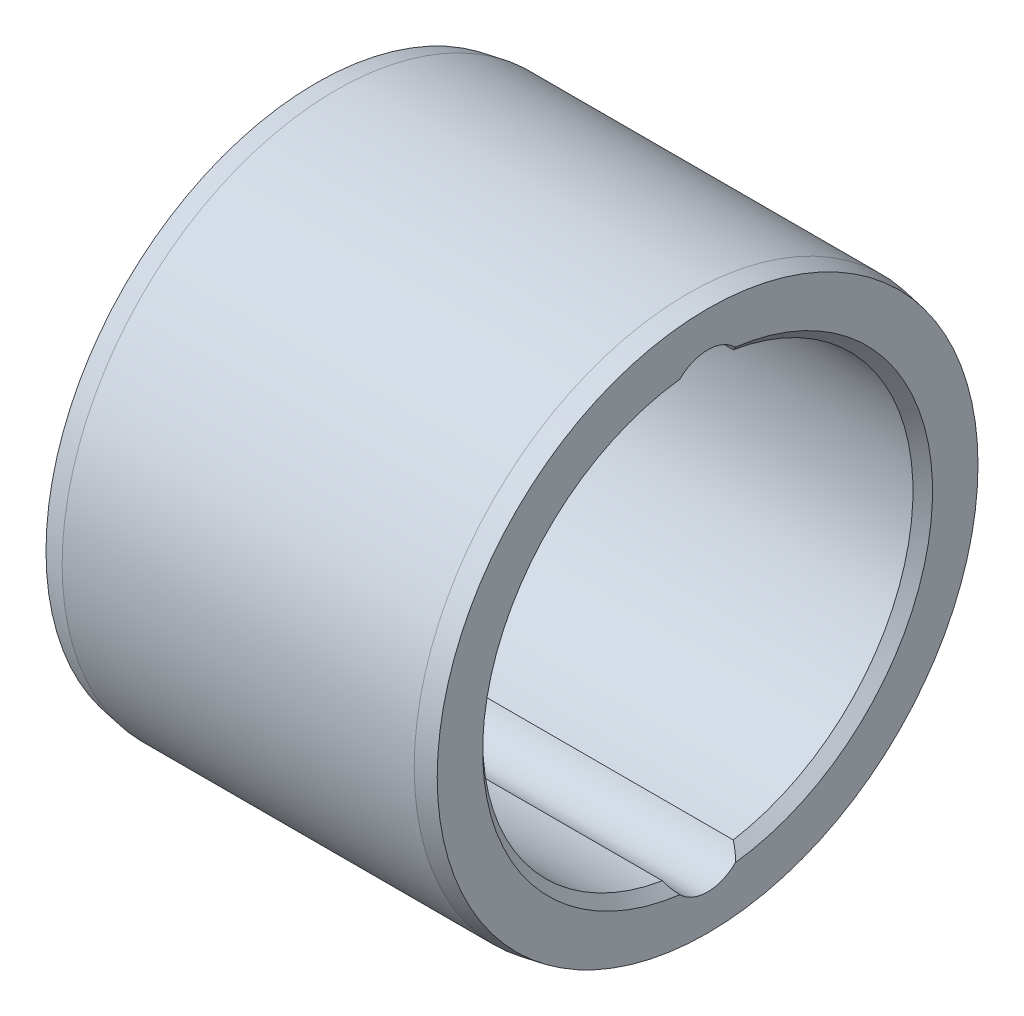
from build123d import *

# Parameters (mm, degrees)
CUT_EXTRUDE_START   = -18
CUT_EXTRUDE_1_DEPTH = 18
FILLET_1_R          = 1.5


with BuildPart() as part:
    # Эскиз1 → Повернуть1 (revolve)
    with BuildSketch(Plane.XY, mode=Mode.PRIVATE) as revolve_1_sk:
        Polygon((0, 11.5), (0, 13.823673019), (1, 14), (19, 14), (20, 13.823673019), (20, 11.5), (19.5, 11), (0.5, 11), align=None)
    revolve(revolve_1_sk.sketch.rotate(Axis((-7.002814628, 0, 0), (1, 0, 0)), 90), axis=Axis((-7.002814628, 0, 0), (1, 0, 0)))

    # Эскиз2 → Вырез-Вытянуть1 (cut)
    with BuildSketch(Plane(origin=(20, 0, 0), x_dir=(0, 0, -1), z_dir=(1, 0, 0)).offset(CUT_EXTRUDE_START)):
        with BuildLine():
            ThreePointArc((-1.810386699, -10.85), (0, -11), (1.810386699, -10.85))
            ThreePointArc((1.810386699, -10.85), (0, -12), (-1.810386699, -10.85))
        make_face()
        with BuildLine():
            ThreePointArc((-1.810386699, 10.85), (0, 12), (1.810386699, 10.85))
            ThreePointArc((1.810386699, 10.85), (0, 11), (-1.810386699, 10.85))
        make_face()
    extrude(amount=CUT_EXTRUDE_1_DEPTH, mode=Mode.SUBTRACT)

    # Скругление1
    # the kernel refuses this fillet: 1.5 mm, written as the material it adds along each edge
    with BuildSketch(Plane(origin=(2, 10, 0), x_dir=(0, -0.9911428491773114, 0.132800047156171), z_dir=(0, -0.132800047156171, -0.9911428491773114))) as fillet_1_piece_1_section:
        with BuildLine():
            CenterArc((2 - FILLET_1_R, -FILLET_1_R), FILLET_1_R, 0, 90)
            Line((2, -FILLET_1_R), (2, 0))
            Line((2, 0), (2 - FILLET_1_R, 0))
        make_face()
    fillet_1_piece_1 = revolve(axis=Axis((2, 10, 0), (-1, 0, 0)), revolution_arc=344.737147097, mode=Mode.PRIVATE)
    fillet_1_piece_1 = fillet_1_piece_1 - Plane(origin=(2.626804304, 0, 0), x_dir=(0, 0, 1), z_dir=(-1, 0, 0)) * Cylinder(11, 8, mode=Mode.PRIVATE)
    add(fillet_1_piece_1)
    with BuildSketch(Plane(origin=(2, -10, 0), x_dir=(0, 0.9911428491773114, -0.132800047156171), z_dir=(0, 0.132800047156171, 0.9911428491773114))) as fillet_1_piece_2_section:
        with BuildLine():
            CenterArc((2 - FILLET_1_R, -FILLET_1_R), FILLET_1_R, 0, 90)
            Line((2, -FILLET_1_R), (2, 0))
            Line((2, 0), (2 - FILLET_1_R, 0))
        make_face()
    fillet_1_piece_2 = revolve(axis=Axis((2, -10, 0), (-1, 0, 0)), revolution_arc=344.737147097, mode=Mode.PRIVATE)
    fillet_1_piece_2 = fillet_1_piece_2 - Plane(origin=(2.626804304, 0, 0), x_dir=(0, 0, 1), z_dir=(-1, 0, 0)) * Cylinder(11, 8, mode=Mode.PRIVATE)
    add(fillet_1_piece_2)


solid = part.part
